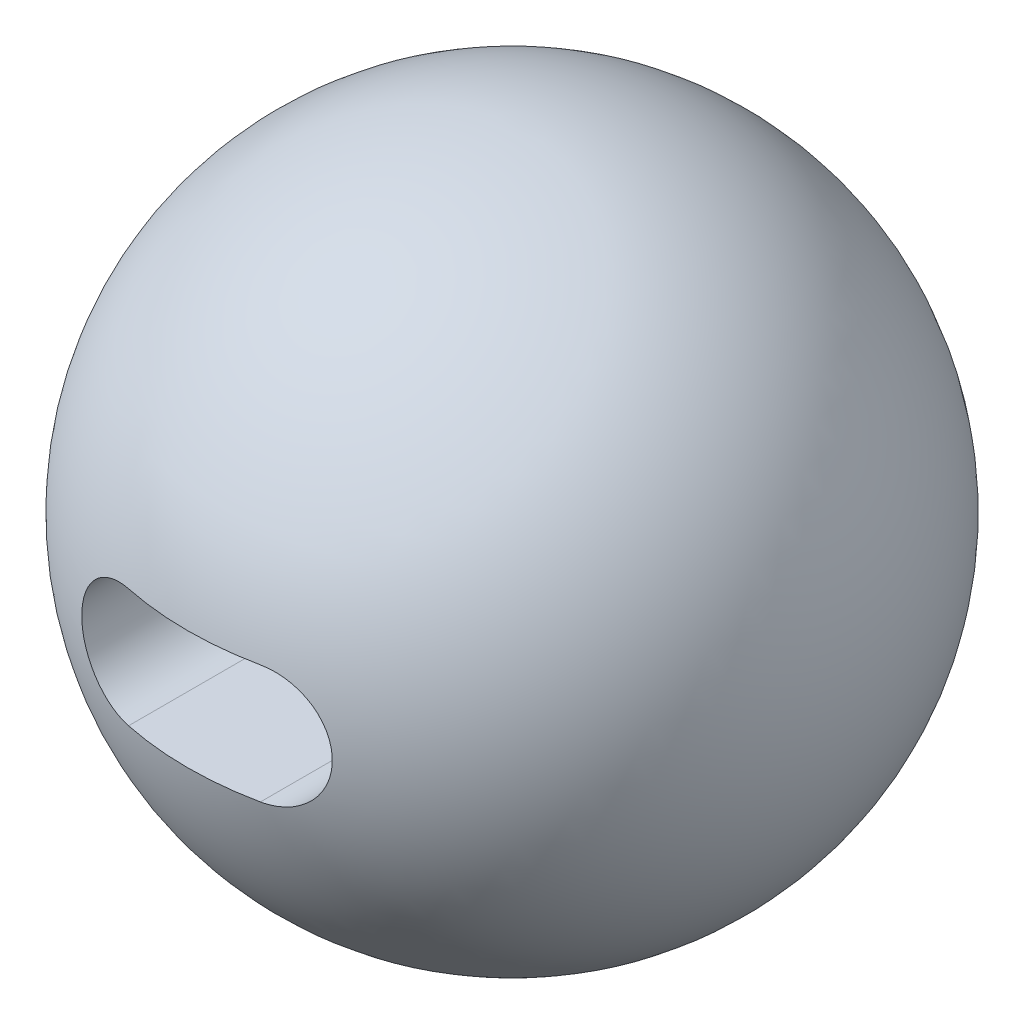
from build123d import *

# Parameters (mm, degrees)
CUT_EXTRUDE2_DEPTH = 500


with BuildPart() as part:
    # Sketch1 → Revolve1 (revolve)
    with BuildSketch(Plane.XY):
        with BuildLine():
            Line((0, -500), (0, 500))
            ThreePointArc((0, 500), (-500, 0), (0, -500))
        make_face()
    revolve(axis=Axis((0, -500, 0), (0, 1, 0)))

    # Sketch7 → Cut-Extrude2 (cut)
    with BuildSketch(Plane.XY.offset(500)):
        with BuildLine():
            Line((-100, 90), (100, 90))
            ThreePointArc((100, 90), (190, 0), (100, -90))
            Line((100, -90), (-100, -90))
            ThreePointArc((-100, -90), (-190, 0), (-100, 90))
        make_face()
    extrude(amount=-CUT_EXTRUDE2_DEPTH, mode=Mode.SUBTRACT)


solid = part.part
